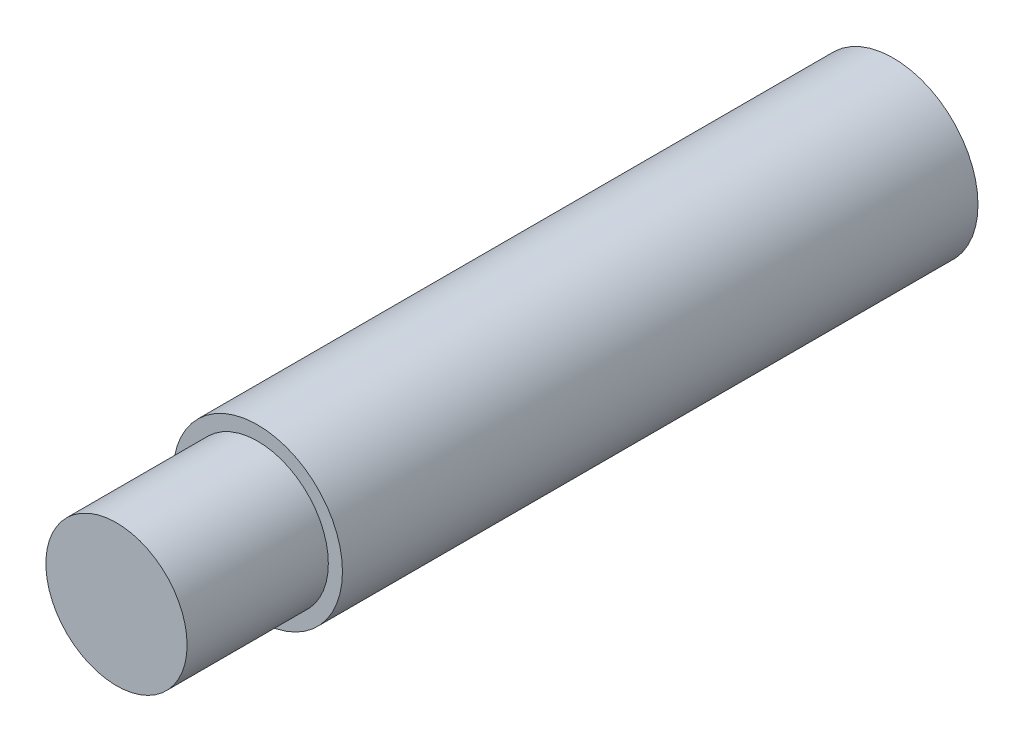
from build123d import *


with BuildPart() as part:
    # Sketch1 → Revolve1 (revolve)
    with BuildSketch(Plane(origin=(0, 0, 0), x_dir=(0, 0, -1), z_dir=(1, 0, 0))):
        Polygon((0, 0), (45, 0), (45, 3.5), (55, 3.5), (55, 6), (10, 6), (10, 5), (0, 5), align=None)
    revolve(axis=Axis((0, 0, 0), (0, 0, -1)))


solid = part.part
